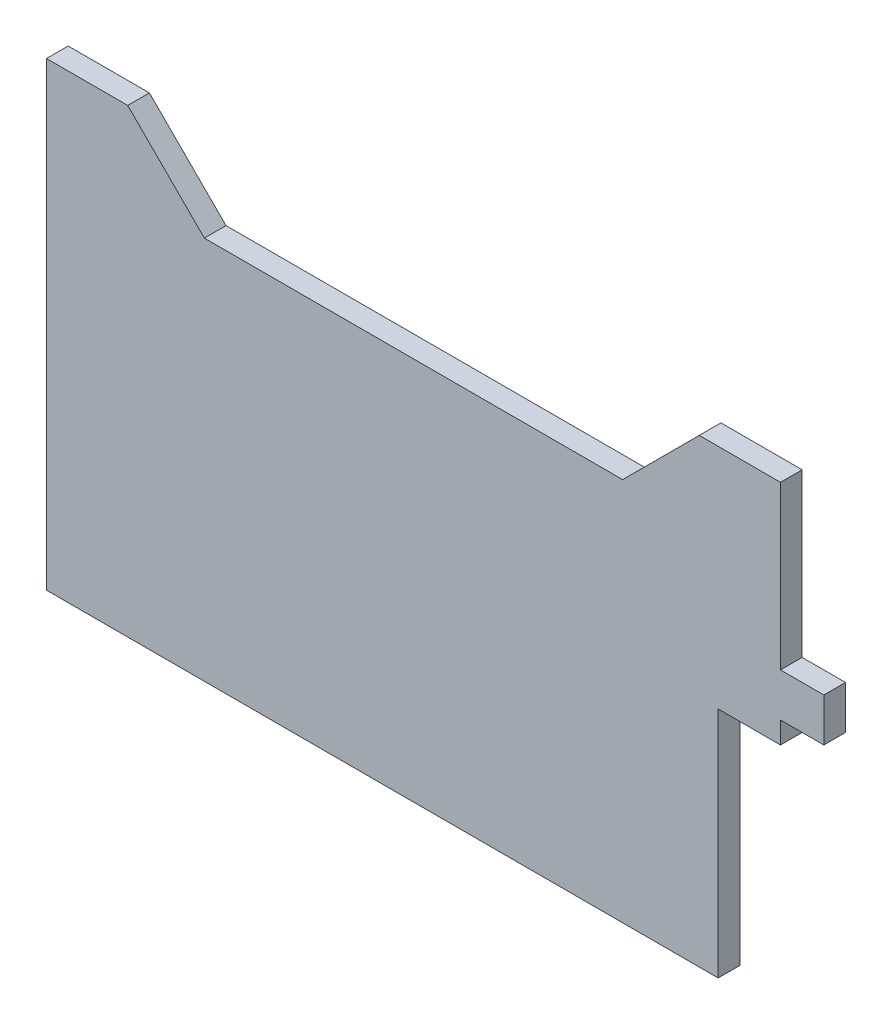
from build123d import *

# Parameters (mm, degrees)
BOSS_EXTRUDE1_DEPTH = 4
BOSS_EXTRUDE2_DEPTH = 4


with BuildPart() as part:
    # Sketch1 → Boss-Extrude1 (new body)
    with BuildSketch(Plane.XY):
        Polygon((40.333746833, 32.200893004), (47.833746833, 32.200893004), (47.833746833, 27.200893004), (55.833746833, 27.200893004), (55.833746833, 19.200893004), (47.833746833, 19.200893004), (47.833746833, 15.200893004), (40.333746833, 15.200893004), (36.333746833, 15.200893004), (36.333746833, -27.799106996), (-87.666253167, -27.799106996), (-87.666253167, 32.200893004), align=None)
    extrude(amount=BOSS_EXTRUDE1_DEPTH)

    # Sketch2 → Boss-Extrude2 (add)
    with BuildSketch(Plane.XY):
        Polygon((-87.666253167, 32.200893004), (47.833746833, 32.200893004), (47.833746833, 57.200893004), (32.833746833, 57.200893004), (18.69161121, 43.058757381), (-58.524117543, 43.058757381), (-72.666253167, 57.200893004), (-87.666253167, 57.200893004), align=None)
    extrude(amount=BOSS_EXTRUDE2_DEPTH)


solid = part.part
